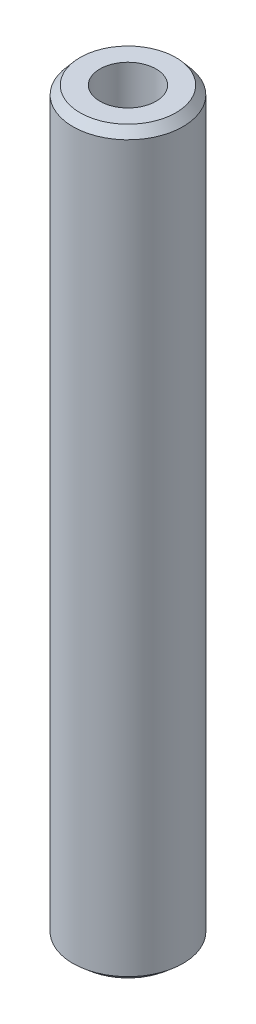
from build123d import *
from OCP.BRepFilletAPI import BRepFilletAPI_MakeChamfer

# Parameters (mm, degrees)
SKETCH1_R           = 22.5
BOSS_EXTRUDE1_DEPTH = 302.45899485
SKETCH2_R           = 11.460100664
CUT_EXTRUDE1_DEPTH  = 305.128169635
CHAMFER1_SIZE       = 3.451114378
CHAMFER1_SIZE2      = 2.926926911


with BuildPart() as part:
    # Sketch1 → Boss-Extrude1 (new body)
    with BuildSketch(Plane(origin=(0, 0, 0), x_dir=(1, 0, 0), z_dir=(0, 1, 0))):
        Circle(SKETCH1_R)
    extrude(amount=BOSS_EXTRUDE1_DEPTH)

    # Sketch2 → Cut-Extrude1 (cut, through all)
    with BuildSketch(Plane(origin=(0, 0, 0), x_dir=(1, 0, 0), z_dir=(0, 1, 0))):
        Circle(SKETCH2_R)
    extrude(amount=CUT_EXTRUDE1_DEPTH, mode=Mode.SUBTRACT)

    # Chamfer1: one chamfer whose edges measure the first distance from different faces: ONE call of the kernel's chamfer builder (chamfer() names one face for all edges)
    chamfer1_edges_1 = [part.edges().sort_by_distance(p)[0] for p in [
        (-22.5, 302.45899485, 0),
    ]]
    chamfer1_side_1 = [part.faces().sort_by_distance(p)[0] for p in [
        (-22.5, 151.229497425, 0),
    ]]
    chamfer1_edges_2 = [part.edges().sort_by_distance(p)[0] for p in [
        (-22.5, 0, 0),
    ]]
    chamfer1_side_2 = [part.faces().sort_by_distance(p)[0] for p in [
        (-21.863603897, 0, 0),
    ]]
    chamfer1 = BRepFilletAPI_MakeChamfer(part.part.solid().wrapped)
    for e in chamfer1_edges_1:
        chamfer1.Add(CHAMFER1_SIZE, CHAMFER1_SIZE2, e.wrapped, chamfer1_side_1[0].wrapped)  # the first distance lies on this face
    for e in chamfer1_edges_2:
        chamfer1.Add(CHAMFER1_SIZE, CHAMFER1_SIZE2, e.wrapped, chamfer1_side_2[0].wrapped)  # the first distance lies on this face
    add(Compound.cast(chamfer1.Shape()), mode=Mode.REPLACE)


solid = part.part
